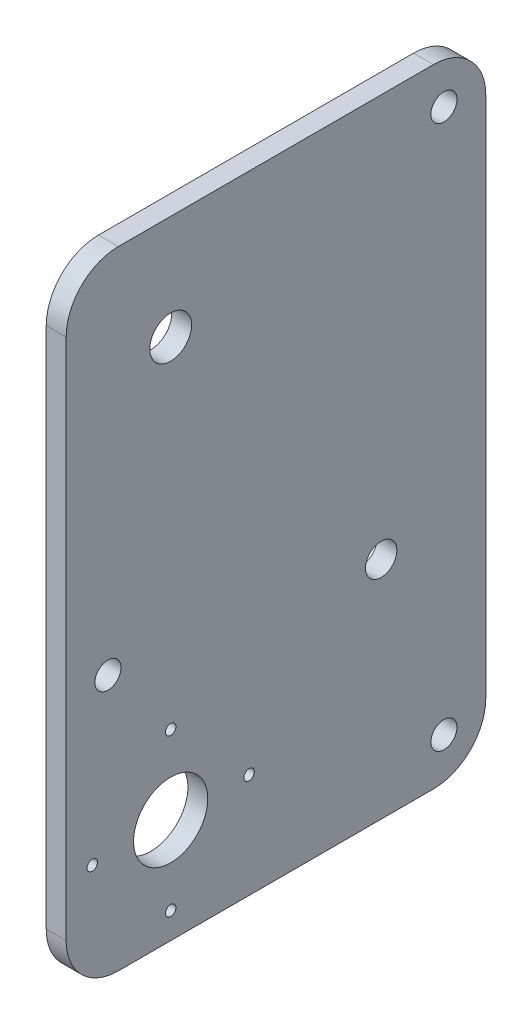
from build123d import *

# Parameters (mm, degrees)
SKETCH1_W           = 80.27017547
SKETCH1_H           = 120
SKETCH1_R           = 4
SKETCH1_R_2         = 7.1
SKETCH1_R_3         = 3
SKETCH1_R_4         = 1
SKETCH1_R_5         = 2.5
BOSS_EXTRUDE1_DEPTH = 3.8
FILLET1_R           = 10


with BuildPart() as part:
    # Sketch1 → Boss-Extrude1 (new body)
    with BuildSketch(Plane(origin=(0, 0, 0), x_dir=(0, 0, -1), z_dir=(1, 0, 0))):
        with Locations((22.195139842, -58.413555688)):
            Rectangle(SKETCH1_W, SKETCH1_H)
        with Locations((2.060052107, -18.413555688)):
            Circle(SKETCH1_R, mode=Mode.SUBTRACT)
        with Locations((2.060052107, -98.413555688)):
            Circle(SKETCH1_R_2, mode=Mode.SUBTRACT)
        with Locations((42.330227577, -75.364196313)):
            Circle(SKETCH1_R_3, mode=Mode.SUBTRACT)
        with Locations((2.060052107, -83.413555688)):
            Circle(SKETCH1_R_4, mode=Mode.SUBTRACT)
        with Locations((17.060052107, -98.413555688)):
            Circle(SKETCH1_R_4, mode=Mode.SUBTRACT)
        with Locations((2.060052107, -113.413555688)):
            Circle(SKETCH1_R_4, mode=Mode.SUBTRACT)
        with Locations((-12.939947893, -98.413555688)):
            Circle(SKETCH1_R_4, mode=Mode.SUBTRACT)
        with Locations((54.330227577, -6.413555688)):
            Circle(SKETCH1_R_5, mode=Mode.SUBTRACT)
        with Locations((54.330227577, -110.413555688)):
            Circle(SKETCH1_R_5, mode=Mode.SUBTRACT)
        with Locations((-9.939947893, -68.413555688)):
            Circle(SKETCH1_R_5, mode=Mode.SUBTRACT)
    extrude(amount=BOSS_EXTRUDE1_DEPTH)

    # Fillet1
    fillet1_edges = [part.edges().sort_by_distance(p)[0] for p in [
        (1.9, 1.586444312, 17.939947893),
        (1.9, 1.586444312, -62.330227577),
        (1.9, -118.413555688, -62.330227577),
        (1.9, -118.413555688, 17.939947893),
    ]]
    fillet(fillet1_edges, radius=FILLET1_R)


solid = part.part
